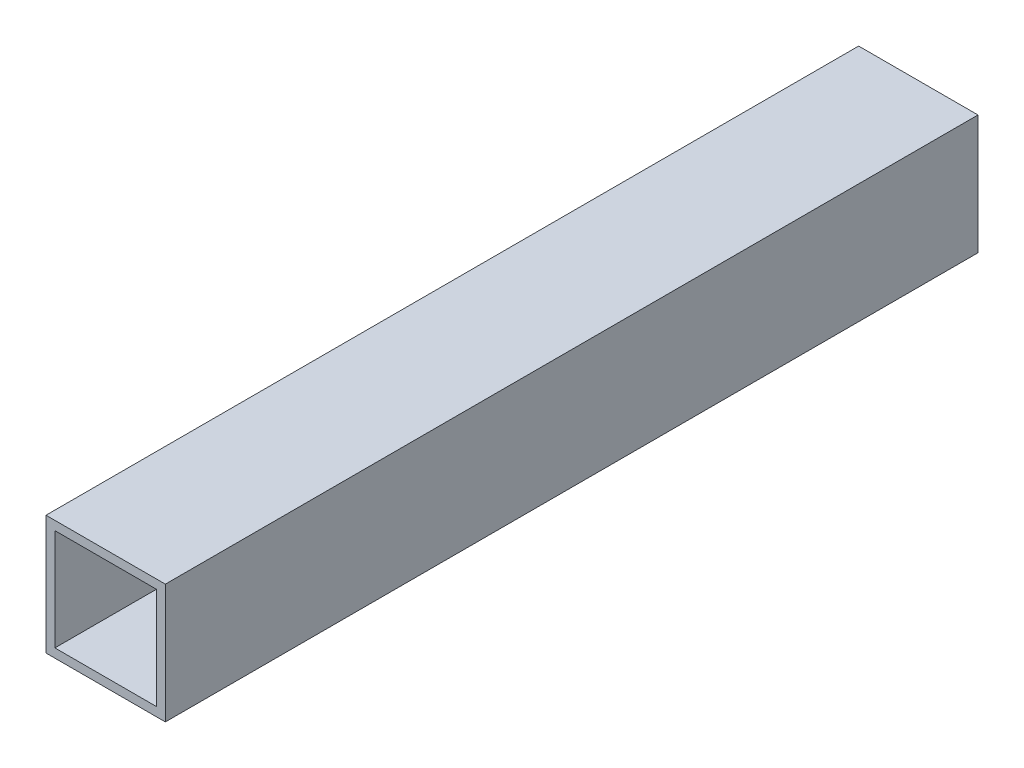
from build123d import *

# Parameters (mm, degrees)
ESQUISSE1_W        = 23.5
ESQUISSE1_H        = 23.5
ESQUISSE1_W_2      = 20
ESQUISSE1_H_2      = 20
BOSS_EXTRU_1_DEPTH = 160


with BuildPart() as part:
    # Esquisse1 → Boss.-Extru.1 (new body)
    with BuildSketch(Plane.XY):
        Rectangle(ESQUISSE1_W, ESQUISSE1_H)
        Rectangle(ESQUISSE1_W_2, ESQUISSE1_H_2, mode=Mode.SUBTRACT)
    extrude(amount=BOSS_EXTRU_1_DEPTH)


solid = part.part
